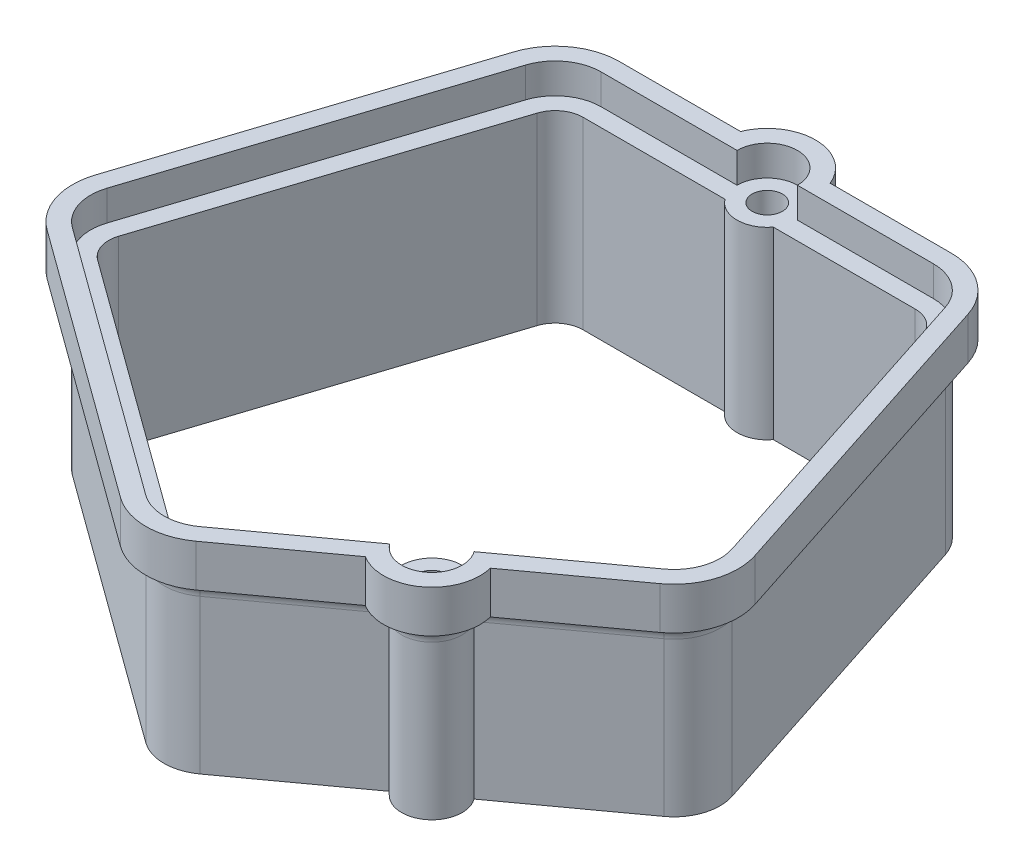
from build123d import *

# Parameters (mm, degrees)
SKETCH1_R                = 2.5
BOSS_EXTRUDE1_DEPTH      = 40
BOSS_EXTRUDE2_DEPTH      = 5
BOSS_EXTRUDE2_DEPTH_BACK = 2
FILLET1_R                = 3
BOSS_EXTRUDE3_START      = 7
SKETCH3_R                = 2.5
BOSS_EXTRUDE3_DEPTH      = 7
SKETCH4_R                = 2.5
CUT_EXTRUDE1_DEPTH       = 16.52


with BuildPart() as part:
    # Sketch1 → Boss-Extrude1 (new body)
    # profile 1 of 3: a face of its own
    with BuildSketch(Plane(origin=(0, 0, 0), x_dir=(1, 0, 0), z_dir=(0, 1, 0))):
        with BuildLine():
            Line((55.989380272, -10.721623107), (38.994348201, 41.58370731))
            ThreePointArc((38.994348201, 41.58370731), (36.22622117, 45.39370731), (31.747297547, 46.848997812))
            Line((31.747297547, 46.848997812), (9.248758018, 46.848997812))
            ThreePointArc((9.248758018, 46.848997812), (7.784291924, 50.384531718), (4.248758018, 51.848997812))
            Line((4.248758018, 51.848997812), (4.248758018, 50.848997812))
            ThreePointArc((4.248758018, 50.848997812), (1.420330893, 49.677424937), (0.248758018, 46.848997812))
            Line((0.248758018, 46.848997812), (-23.249781512, 46.848997812))
            ThreePointArc((-23.249781512, 46.848997812), (-27.728705135, 45.39370731), (-30.496832166, 41.58370731))
            Line((-30.496832166, 41.58370731), (-47.491864237, -10.721623107))
            ThreePointArc((-47.491864237, -10.721623107), (-47.491864237, -15.431042101), (-44.723737205, -19.241042101))
            Line((-44.723737205, -19.241042101), (-0.230165605, -51.567514092))
            ThreePointArc((-0.230165605, -51.567514092), (4.248758018, -53.022804594), (8.72768164, -51.567514092))
            Line((8.72768164, -51.567514092), (27.738399463, -37.755419106))
            ThreePointArc((27.738399463, -37.755419106), (30.34872958, -39.355031459), (33.325608449, -38.640346074))
            Line((33.325608449, -38.640346074), (33.913393702, -39.449363068))
            ThreePointArc((33.913393702, -39.449363068), (35.912909143, -36.186450422), (35.019552412, -32.465351835))
            Line((35.019552412, -32.465351835), (53.22125324, -19.241042101))
            ThreePointArc((53.22125324, -19.241042101), (55.989380272, -15.431042101), (55.989380272, -10.721623107))
        make_face()
        with Locations(Location((4.248758018, 46.848997812, 0), (0, 0, 270))):
            Circle(SKETCH1_R, mode=Mode.SUBTRACT)
        with Locations(Location((30.97446744, -35.404278096, 0), (0, 0, 270))):
            Circle(SKETCH1_R, mode=Mode.SUBTRACT)
        with BuildLine():
            ThreePointArc((-23.249781512, 43.848997812), (-25.965349378, 42.966656326), (-27.643662617, 40.656656326))
            Line((-27.643662617, 40.656656326), (-44.638694688, -11.64867409))
            ThreePointArc((-44.638694688, -11.64867409), (-44.638694688, -14.503991118), (-42.960381448, -16.813991118))
            Line((-42.960381448, -16.813991118), (1.533190152, -49.140463108))
            ThreePointArc((1.533190152, -49.140463108), (4.248758018, -50.022804594), (6.964325883, -49.140463108))
            Line((6.964325883, -49.140463108), (25.975043706, -35.328368122))
            ThreePointArc((25.975043706, -35.328368122), (28.035541179, -31.359193125), (32.447179661, -30.626086104))
            Line((32.447179661, -30.626086104), (51.457897483, -16.813991118))
            ThreePointArc((51.457897483, -16.813991118), (53.136210723, -14.503991118), (53.136210723, -11.64867409))
            Line((53.136210723, -11.64867409), (36.141178653, 40.656656326))
            ThreePointArc((36.141178653, 40.656656326), (34.462865413, 42.966656326), (31.747297547, 43.848997812))
            Line((31.747297547, 43.848997812), (8.248758018, 43.848997812))
            ThreePointArc((8.248758018, 43.848997812), (4.248758018, 41.848997812), (0.248758018, 43.848997812))
            Line((0.248758018, 43.848997812), (-23.249781512, 43.848997812))
        make_face(mode=Mode.SUBTRACT)
    # profile 2 of 3: a face of its own
    with BuildSketch(Plane(origin=(0, 0, 0), x_dir=(1, 0, 0), z_dir=(0, 1, 0))):
        with BuildLine():
            ThreePointArc((26.929382468, -38.343204358), (30.192295115, -40.342719799), (33.913393702, -39.449363068))
            Line((33.913393702, -39.449363068), (33.325608449, -38.640346074))
            ThreePointArc((33.325608449, -38.640346074), (30.34872958, -39.355031459), (27.738399463, -37.755419106))
            Line((27.738399463, -37.755419106), (26.929382468, -38.343204358))
        make_face()
    # profile 3 of 3: a face of its own
    with BuildSketch(Plane(origin=(0, 0, 0), x_dir=(1, 0, 0), z_dir=(0, 1, 0))):
        with BuildLine():
            Line((4.248758018, 50.848997812), (4.248758018, 51.848997812))
            ThreePointArc((4.248758018, 51.848997812), (0.713224112, 50.384531718), (-0.751241982, 46.848997812))
            Line((-0.751241982, 46.848997812), (0.248758018, 46.848997812))
            ThreePointArc((0.248758018, 46.848997812), (1.420330893, 49.677424937), (4.248758018, 50.848997812))
        make_face()
    extrude(amount=BOSS_EXTRUDE1_DEPTH)

    # Sketch2 → Boss-Extrude2 (add, two sides: drawn at the far end of the back side and taken through both)
    with BuildSketch(Plane(origin=(0, 40, 0), x_dir=(1, 0, 0), z_dir=(0, 1, 0)).offset(-BOSS_EXTRUDE2_DEPTH_BACK)):
        Polygon((-30.496832166, 41.58370731), (-33.350001715, 42.510758293), (-50.345033785, -9.794572124), (-47.491864237, -10.721623107), align=None)
        with BuildLine():
            Line((-1.993521362, -53.994565075), (-46.487092962, -21.668093084))
            ThreePointArc((-46.487092962, -21.668093084), (-50.345033785, -16.358093084), (-50.345033785, -9.794572124))
            Line((-50.345033785, -9.794572124), (-47.491864237, -10.721623107))
            ThreePointArc((-47.491864237, -10.721623107), (-47.491864237, -15.431042101), (-44.723737205, -19.241042101))
            Line((-44.723737205, -19.241042101), (-0.230165605, -51.567514092))
            ThreePointArc((-0.230165605, -51.567514092), (4.248758018, -53.022804594), (8.72768164, -51.567514092))
            Line((8.72768164, -51.567514092), (26.929382468, -38.343204358))
            ThreePointArc((26.929382468, -38.343204358), (33.913393702, -39.449363068), (35.019552412, -32.465351835))
            Line((35.019552412, -32.465351835), (53.22125324, -19.241042101))
            ThreePointArc((53.22125324, -19.241042101), (55.989380272, -15.431042101), (55.989380272, -10.721623107))
            Line((55.989380272, -10.721623107), (38.994348201, 41.58370731))
            ThreePointArc((38.994348201, 41.58370731), (36.22622117, 45.39370731), (31.747297547, 46.848997812))
            Line((31.747297547, 46.848997812), (9.248758018, 46.848997812))
            ThreePointArc((9.248758018, 46.848997812), (4.248758018, 51.848997812), (-0.751241982, 46.848997812))
            Line((-0.751241982, 46.848997812), (-23.249781512, 46.848997812))
            Line((-23.249781512, 46.848997812), (-23.249781512, 49.848997812))
            Line((-23.249781512, 49.848997812), (-3.16744047, 49.848997812))
            ThreePointArc((-3.16744047, 49.848997812), (4.248758018, 54.848997812), (11.664956505, 49.848997812))
            Line((11.664956505, 49.848997812), (31.747297547, 49.848997812))
            ThreePointArc((31.747297547, 49.848997812), (37.989576927, 47.820758293), (41.84751775, 42.510758293))
            Line((41.84751775, 42.510758293), (58.842549821, -9.794572124))
            ThreePointArc((58.842549821, -9.794572124), (58.842549821, -16.358093084), (54.984608997, -21.668093084))
            Line((54.984608997, -21.668093084), (38.737653807, -33.472196981))
            ThreePointArc((38.737653807, -33.472196981), (35.676749458, -41.876414051), (26.737992587, -42.190461178))
            Line((26.737992587, -42.190461178), (10.491037397, -53.994565075))
            ThreePointArc((10.491037397, -53.994565075), (4.248758018, -56.022804594), (-1.993521362, -53.994565075))
        make_face()
        with BuildLine():
            ThreePointArc((-33.350001715, 42.510758293), (-29.492060891, 47.820758293), (-23.249781512, 49.848997812))
            Line((-23.249781512, 49.848997812), (-23.249781512, 46.848997812))
            ThreePointArc((-23.249781512, 46.848997812), (-27.728705135, 45.39370731), (-30.496832166, 41.58370731))
            Line((-30.496832166, 41.58370731), (-33.350001715, 42.510758293))
        make_face()
    extrude(amount=BOSS_EXTRUDE2_DEPTH + BOSS_EXTRUDE2_DEPTH_BACK)

    # Fillet1
    fillet1_edges = [part.edges().sort_by_distance(p)[0] for p in [
        (-38.994348201, 38, -15.431042101),
        (-47.491864237, 38, 15.431042101),
        (-22.476951405, 38, 35.404278096),
        (4.248758018, 38, 53.022804594),
        (17.828532054, 38, 44.955359225),
        (33.913393702, 38, 39.449363068),
        (44.120402826, 38, 25.853196968),
        (55.989380272, 38, 15.431042101),
        (47.491864237, 38, -15.431042101),
        (36.22622117, 38, -45.39370731),
        (20.498027782, 38, -46.848997812),
        (4.248758018, 38, -51.848997812),
        (-12.000511747, 38, -46.848997812),
        (-27.728705135, 38, -45.39370731),
    ]]
    fillet(fillet1_edges, radius=FILLET1_R - 0.0001)  # a hair under: the kernel refuses the full size

    # Sketch3 → Boss-Extrude3 (add)
    with BuildSketch(Plane.XZ.offset(BOSS_EXTRUDE3_START)):
        with BuildLine():
            Line((38.994348201, -41.58370731), (55.989380272, 10.721623107))
            ThreePointArc((55.989380272, 10.721623107), (55.989380272, 15.431042101), (53.22125324, 19.241042101))
            Line((53.22125324, 19.241042101), (35.019552412, 32.465351835))
            ThreePointArc((35.019552412, 32.465351835), (33.913393702, 39.449363068), (26.929382468, 38.343204358))
            Line((26.929382468, 38.343204358), (8.72768164, 51.567514092))
            ThreePointArc((8.72768164, 51.567514092), (4.248758018, 53.022804594), (-0.230165605, 51.567514092))
            Line((-0.230165605, 51.567514092), (-44.723737205, 19.241042101))
            ThreePointArc((-44.723737205, 19.241042101), (-47.491864237, 15.431042101), (-47.491864237, 10.721623107))
            Line((-47.491864237, 10.721623107), (-30.496832166, -41.58370731))
            ThreePointArc((-30.496832166, -41.58370731), (-27.728705135, -45.39370731), (-23.249781512, -46.848997812))
            Line((-23.249781512, -46.848997812), (-0.751241982, -46.848997812))
            ThreePointArc((-0.751241982, -46.848997812), (4.248758018, -51.848997812), (9.248758018, -46.848997812))
            Line((9.248758018, -46.848997812), (31.747297547, -46.848997812))
            ThreePointArc((31.747297547, -46.848997812), (36.22622117, -45.39370731), (38.994348201, -41.58370731))
        make_face()
        with Locations(Location((30.97446744, 35.404278096, 0), (0, 0, 270))):
            Circle(SKETCH3_R, mode=Mode.SUBTRACT)
        with Locations(Location((4.248758018, -46.848997812, 0), (0, 0, 270))):
            Circle(SKETCH3_R, mode=Mode.SUBTRACT)
        with BuildLine():
            Line((-44.638694688, 11.64867409), (-27.643662617, -40.656656326))
            ThreePointArc((-27.643662617, -40.656656326), (-25.965349378, -42.966656326), (-23.249781512, -43.848997812))
            Line((-23.249781512, -43.848997812), (0.248758018, -43.848997812))
            ThreePointArc((0.248758018, -43.848997812), (4.248758018, -41.848997812), (8.248758018, -43.848997812))
            Line((8.248758018, -43.848997812), (31.747297547, -43.848997812))
            ThreePointArc((31.747297547, -43.848997812), (34.462865413, -42.966656326), (36.141178653, -40.656656326))
            Line((36.141178653, -40.656656326), (53.136210723, 11.64867409))
            ThreePointArc((53.136210723, 11.64867409), (53.136210723, 14.503991118), (51.457897483, 16.813991118))
            Line((51.457897483, 16.813991118), (32.447179661, 30.626086104))
            ThreePointArc((32.447179661, 30.626086104), (28.035541179, 31.359193125), (25.975043706, 35.328368122))
            Line((25.975043706, 35.328368122), (6.964325883, 49.140463108))
            ThreePointArc((6.964325883, 49.140463108), (4.248758018, 50.022804594), (1.533190152, 49.140463108))
            Line((1.533190152, 49.140463108), (-42.960381448, 16.813991118))
            ThreePointArc((-42.960381448, 16.813991118), (-44.638694688, 14.503991118), (-44.638694688, 11.64867409))
        make_face(mode=Mode.SUBTRACT)
    extrude(amount=-BOSS_EXTRUDE3_DEPTH)

    # Sketch4 → Cut-Extrude1 (cut)
    with BuildSketch(Plane.XZ.offset(7)):
        with BuildLine():
            Line((38.994348201, -41.58370731), (55.989380272, 10.721623107))
            ThreePointArc((55.989380272, 10.721623107), (55.989380272, 15.431042101), (53.22125324, 19.241042101))
            Line((53.22125324, 19.241042101), (35.019552412, 32.465351835))
            ThreePointArc((35.019552412, 32.465351835), (33.913393702, 39.449363068), (26.929382468, 38.343204358))
            Line((26.929382468, 38.343204358), (8.72768164, 51.567514092))
            ThreePointArc((8.72768164, 51.567514092), (4.248758018, 53.022804594), (-0.230165605, 51.567514092))
            Line((-0.230165605, 51.567514092), (-44.723737205, 19.241042101))
            ThreePointArc((-44.723737205, 19.241042101), (-47.491864237, 15.431042101), (-47.491864237, 10.721623107))
            Line((-47.491864237, 10.721623107), (-30.496832166, -41.58370731))
            ThreePointArc((-30.496832166, -41.58370731), (-27.728705135, -45.39370731), (-23.249781512, -46.848997812))
            Line((-23.249781512, -46.848997812), (-0.751241982, -46.848997812))
            ThreePointArc((-0.751241982, -46.848997812), (4.248758018, -51.848997812), (9.248758018, -46.848997812))
            Line((9.248758018, -46.848997812), (31.747297547, -46.848997812))
            ThreePointArc((31.747297547, -46.848997812), (36.22622117, -45.39370731), (38.994348201, -41.58370731))
        make_face()
        with Locations(Location((30.97446744, 35.404278096, 0), (0, 0, 270))):
            Circle(SKETCH4_R, mode=Mode.SUBTRACT)
        with Locations(Location((4.248758018, -46.848997812, 0), (0, 0, 270))):
            Circle(SKETCH4_R, mode=Mode.SUBTRACT)
        with BuildLine():
            Line((-23.249781512, -43.848997812), (0.248758018, -43.848997812))
            ThreePointArc((0.248758018, -43.848997812), (4.248758018, -41.848997812), (8.248758018, -43.848997812))
            Line((8.248758018, -43.848997812), (31.747297547, -43.848997812))
            ThreePointArc((31.747297547, -43.848997812), (34.462865413, -42.966656326), (36.141178653, -40.656656326))
            Line((36.141178653, -40.656656326), (53.136210723, 11.64867409))
            ThreePointArc((53.136210723, 11.64867409), (53.136210723, 14.503991118), (51.457897483, 16.813991118))
            Line((51.457897483, 16.813991118), (32.447179661, 30.626086104))
            ThreePointArc((32.447179661, 30.626086104), (28.035541179, 31.359193125), (25.975043706, 35.328368122))
            Line((25.975043706, 35.328368122), (6.964325883, 49.140463108))
            ThreePointArc((6.964325883, 49.140463108), (4.248758018, 50.022804594), (1.533190152, 49.140463108))
            Line((1.533190152, 49.140463108), (-42.960381448, 16.813991118))
            ThreePointArc((-42.960381448, 16.813991118), (-44.638694688, 14.503991118), (-44.638694688, 11.64867409))
            Line((-44.638694688, 11.64867409), (-27.643662617, -40.656656326))
            ThreePointArc((-27.643662617, -40.656656326), (-25.965349378, -42.966656326), (-23.249781512, -43.848997812))
        make_face(mode=Mode.SUBTRACT)
    extrude(amount=-CUT_EXTRUDE1_DEPTH, mode=Mode.SUBTRACT)


solid = part.part
